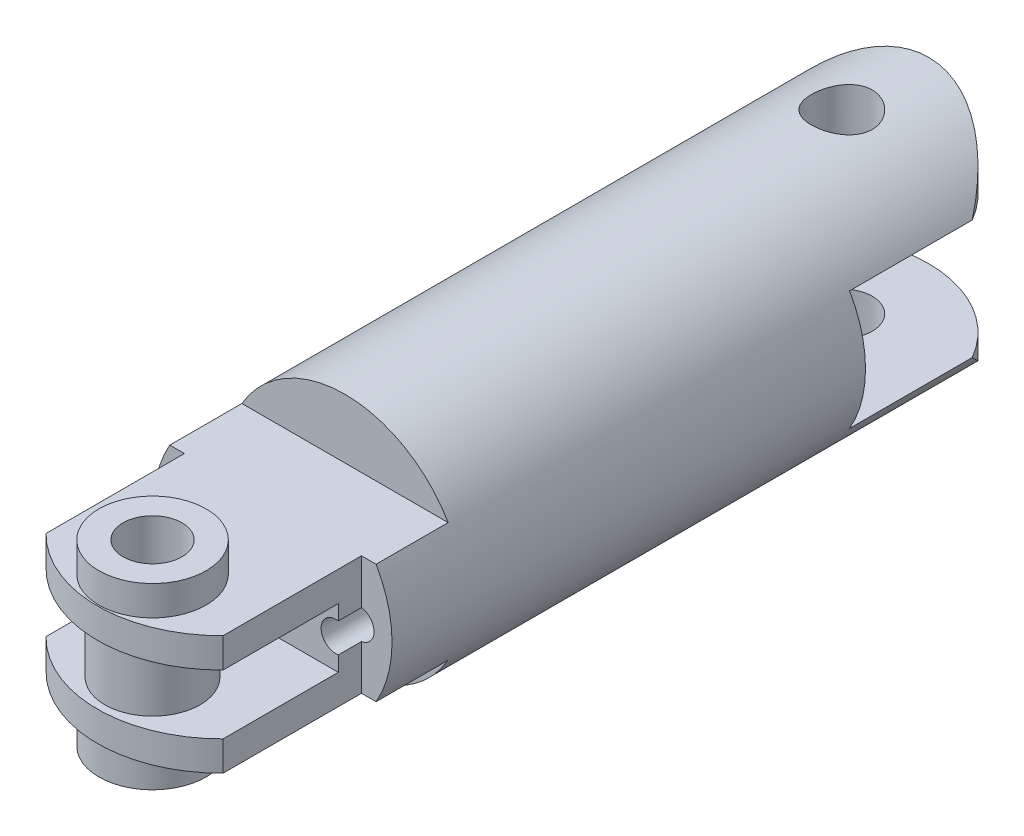
from build123d import *
from build123d.topology import SkipClean

# Parameters (mm, degrees)
SKETCH2_R                       = 10
PHALANGE_LENGTH_DEPTH           = 41.7
BOSS_EXTRUDE3_DEPTH             = 5
BOSS_EXTRUDE4_DEPTH             = 5
BOSS_EXTRUDE4_DEPTH_BACK        = 5
CUT_EXTRUDE2_START              = -15.3025
CUT_EXTRUDE2_DEPTH              = 15.3025
SKETCH7_R                       = 1.65
CUT_EXTRUDE3_DEPTH              = 10
CUT_EXTRUDE4_DEPTH              = 2.5
CUT_EXTRUDE4_DEPTH_BACK         = 2.5
CUT_EXTRUDE7_REACH              = 61.833
SKETCH4_R                       = 1.65
CUT_EXTRUDE7_DIRECTION_2_REACH  = 61.833
CUT_EXTRUDE_THIN1_START         = 41.7
CUT_EXTRUDE_THIN1_DEPTH         = 10.361670454
BOSS_EXTRUDE5_REACH             = 61.255
SKETCH9_R                       = 4
SKETCH9_R_2                     = 1.65
CUT_EXTRUDE8_REACH              = 60.731
SKETCH10_R                      = 1.25
CUT_EXTRUDE9_START              = -8
CUT_EXTRUDE9_DEPTH              = 8
CUT_EXTRUDE10_REACH             = 61.255
CUT_EXTRUDE10_DIRECTION_2_REACH = 61.255
CUT_EXTRUDE11_START             = -10
CUT_EXTRUDE11_OUTLINE_W         = 2.565773848
CUT_EXTRUDE11_OUTLINE_H         = 11.6166929
CUT_EXTRUDE11_DEPTH             = 10
BOSS_EXTRUDE6_START             = 7.5
SKETCH14_R                      = 4.5
SKETCH14_R_2                    = 1.65
BOSS_EXTRUDE6_DEPTH             = 2.5
BOSS_EXTRUDE7_START             = -7.5
SKETCH14_2_R                    = 4.5
SKETCH14_2_R_2                  = 1.65
BOSS_EXTRUDE7_DEPTH             = 2.5
SCALE1_SCALE                    = 0.666666667
CUT_EXTRUDE12_START             = -11.666667
SKETCH15_R                      = 1.65
CUT_EXTRUDE12_DEPTH             = 13.333339
CUT_EXTRUDE13_REACH             = 46.28
SKETCH16_R                      = 1.7
CUT_EXTRUDE13_DIRECTION_2_REACH = 46.28


# Read off the part's stored shape, not the designer's step: Cut-Extrude-Thin1, Cut-Extrude11
with BuildPart() as part:
    # Sketch2 → Phalange Length (new body)
    with BuildSketch(Plane.XY):
        Circle(SKETCH2_R)
    extrude(amount=PHALANGE_LENGTH_DEPTH)

    # Sketch3 → Boss-Extrude3 (add)
    with BuildSketch(Plane(origin=(0, -10, 0), x_dir=(-1, 0, 0), z_dir=(0, -1, 0))):
        with BuildLine():
            Line((-10, 5.302499701), (-10, 0))
            Line((-10, 0), (10, 0))
            Line((10, 0), (10, 5.302499701))
            ThreePointArc((10, 5.302499701), (0, 15.302499701), (-10, 5.302499701))
        make_face()
    boss_extrude3 = extrude(amount=-BOSS_EXTRUDE3_DEPTH)

    # Mirror1: Boss-Extrude3 across plane
    add(boss_extrude3.mirror(Plane.ZX))

    # Sketch5 → Boss-Extrude4 (add, two sides: drawn at the far end of the back side and taken through both)
    with BuildSketch(Plane(origin=(0, 0, 0), x_dir=(1, 0, 0), z_dir=(0, 1, 0)).offset(-BOSS_EXTRUDE4_DEPTH_BACK)):
        with BuildLine():
            Line((-10, -47.483157911), (-10, -41.7))
            Line((-10, -41.7), (10, -41.7))
            Line((10, -41.7), (10, -47.483157911))
            ThreePointArc((10, -47.483157911), (0, -57.051984156), (-10, -47.483157911))
        make_face()
    extrude(amount=BOSS_EXTRUDE4_DEPTH + BOSS_EXTRUDE4_DEPTH_BACK)

    # Sketch6 → Cut-Extrude2 (cut)
    with SkipClean():  # the faces are left unmerged after this step: merging them gives an invalid solid
        with BuildSketch(Plane.XY.offset(CUT_EXTRUDE2_START)):
            with BuildLine():
                ThreePointArc((0, 10), (5, 8.660254038), (8.660254038, 5))
                Line((8.660254038, 5), (10, 5))
                Line((10, 5), (10, 10))
                Line((10, 10), (0, 10))
            make_face()
            with BuildLine():
                Line((10, -5), (8.660254038, -5))
                ThreePointArc((8.660254038, -5), (5, -8.660254038), (0, -10))
                Line((0, -10), (10, -10))
                Line((10, -10), (10, -5))
            make_face()
            with BuildLine():
                ThreePointArc((-8.660254038, 5), (-5, 8.660254038), (0, 10))
                Line((0, 10), (-10, 10))
                Line((-10, 10), (-10, 5))
                Line((-10, 5), (-8.660254038, 5))
            make_face()
            with BuildLine():
                Line((-10, -10), (0, -10))
                ThreePointArc((0, -10), (-5, -8.660254038), (-8.660254038, -5))
                Line((-8.660254038, -5), (-10, -5))
                Line((-10, -5), (-10, -10))
            make_face()
        extrude(amount=CUT_EXTRUDE2_DEPTH, mode=Mode.SUBTRACT)

    # Sketch7 → Cut-Extrude3 (cut)
    with SkipClean():  # the faces are left unmerged after this step: merging them gives an invalid solid
        with BuildSketch(Plane(origin=(0, 5, 0), x_dir=(1, 0, 0), z_dir=(0, 1, 0))):
            with Locations(Location((0, -49.861984156, 0), (0, 0, 270))):
                Circle(SKETCH7_R)
        extrude(amount=-CUT_EXTRUDE3_DEPTH, mode=Mode.SUBTRACT)

    # Sketch5<2> → Cut-Extrude4 (cut, two sides: drawn at the far end of the back side and taken through both)
    with BuildSketch(Plane(origin=(0, 0, 0), x_dir=(1, 0, 0), z_dir=(0, 1, 0)).offset(-CUT_EXTRUDE4_DEPTH_BACK)):
        with BuildLine():
            Line((-10, -47.483157911), (-10, -41.7))
            Line((-10, -41.7), (10, -41.7))
            Line((10, -41.7), (10, -47.483157911))
            ThreePointArc((10, -47.483157911), (0, -57.051984156), (-10, -47.483157911))
        make_face()
    extrude(amount=CUT_EXTRUDE4_DEPTH + CUT_EXTRUDE4_DEPTH_BACK, mode=Mode.SUBTRACT)

    # Sketch4 → Cut-Extrude7 (cut, up to next)
    with BuildSketch(Plane(origin=(0, -5, 0), x_dir=(1, 0, 0), z_dir=(0, 1, 0)), mode=Mode.PRIVATE) as cut_extrude7_sk1:
        with Locations(Location((0, 8.010159673, 0), (0, 0, 270))):
            Circle(SKETCH4_R)
    cut_extrude7_tool1 = extrude(cut_extrude7_sk1.sketch, amount=-CUT_EXTRUDE7_REACH, mode=Mode.PRIVATE) & part.part
    add(cut_extrude7_tool1.solids().sort_by_distance((0, -5, -8.01016))[0], mode=Mode.SUBTRACT)

    # Sketch4 → Cut-Extrude7 direction 2 (cut, up to next)
    with BuildSketch(Plane(origin=(0, -5, 0), x_dir=(1, 0, 0), z_dir=(0, 1, 0)), mode=Mode.PRIVATE) as cut_extrude7_direction_2_sk1:
        with Locations(Location((0, 8.010159673, 0), (0, 0, 270))):
            Circle(SKETCH4_R)
    cut_extrude7_direction_2_tool1 = extrude(cut_extrude7_direction_2_sk1.sketch, amount=CUT_EXTRUDE7_DIRECTION_2_REACH, mode=Mode.PRIVATE) & part.part
    add(cut_extrude7_direction_2_tool1.solids().sort_by_distance((0, -5, -8.01016))[0], mode=Mode.SUBTRACT)

    # Cut-Extrude-Thin1 outline → Cut-Extrude-Thin1 (cut)
    with SkipClean():  # the faces are left unmerged after this step: merging them gives an invalid solid
        with BuildSketch(Plane.XY.offset(CUT_EXTRUDE_THIN1_START)):
            with BuildLine():
                ThreePointArc((8.660254038, 5), (9.256147934, 3.78466979), (9.682458366, 2.5))
                Line((9.682458366, 2.5), (10, 2.5))
                Line((10, 2.5), (10, 5))
                Line((10, 5), (8.660254038, 5))
            make_face()
            with BuildLine():
                Line((10, -2.5), (9.682458366, -2.5))
                ThreePointArc((9.682458366, -2.5), (9.256147934, -3.78466979), (8.660254038, -5))
                Line((8.660254038, -5), (10, -5))
                Line((10, -5), (10, -2.5))
            make_face()
            with BuildLine():
                Line((-10, 2.5), (-9.682458366, 2.5))
                ThreePointArc((-9.682458366, 2.5), (-9.256147934, 3.78466979), (-8.660254038, 5))
                Line((-8.660254038, 5), (-10, 5))
                Line((-10, 5), (-10, 2.5))
            make_face()
            with BuildLine():
                ThreePointArc((-8.660254038, -5), (-9.256147934, -3.78466979), (-9.682458366, -2.5))
                Line((-9.682458366, -2.5), (-10, -2.5))
                Line((-10, -2.5), (-10, -5))
                Line((-10, -5), (-8.660254038, -5))
            make_face()
        extrude(amount=CUT_EXTRUDE_THIN1_DEPTH, mode=Mode.SUBTRACT)

    # Sketch9 → Boss-Extrude5 (add, up to next)
    with BuildSketch(Plane.XZ.offset(-2.5), mode=Mode.PRIVATE) as boss_extrude5_sk1:
        with Locations(Location((0, 49.861984156, 0), (0, 0, 90))):
            Circle(SKETCH9_R)
        with Locations(Location((0, 49.861984156, 0), (0, 0, 90))):
            Circle(SKETCH9_R_2, mode=Mode.SUBTRACT)
    boss_extrude5_tool1 = extrude(boss_extrude5_sk1.sketch, amount=BOSS_EXTRUDE5_REACH, mode=Mode.PRIVATE) - part.part
    add(boss_extrude5_tool1.solids().sort_by_distance((0, 2.5, 45.975121))[0])

    # Sketch10 → Cut-Extrude8 (cut, up to next)
    with BuildSketch(Plane.XY.offset(41.7), mode=Mode.PRIVATE) as cut_extrude8_sk1:
        with Locations((7.239961745, 0)):
            Circle(SKETCH10_R)
    cut_extrude8_tool1 = extrude(cut_extrude8_sk1.sketch, amount=-CUT_EXTRUDE8_REACH, mode=Mode.PRIVATE) & part.part
    # Sketch10 → Cut-Extrude8 (cut, up to next)
    with BuildSketch(Plane.XY.offset(41.7), mode=Mode.PRIVATE) as cut_extrude8_sk2:
        with Locations((-7.239961745, 0)):
            Circle(SKETCH10_R)
    cut_extrude8_tool2 = extrude(cut_extrude8_sk2.sketch, amount=-CUT_EXTRUDE8_REACH, mode=Mode.PRIVATE) & part.part
    add(cut_extrude8_tool1.solids().sort_by_distance((7.239962, 0, 41.7))[0], mode=Mode.SUBTRACT)
    add(cut_extrude8_tool2.solids().sort_by_distance((-7.239962, 0, 41.7))[0], mode=Mode.SUBTRACT)

    # Sketch11 → Cut-Extrude9 (cut)
    with SkipClean():  # the faces are left unmerged after this step: merging them gives an invalid solid
        with BuildSketch(Plane.XY.offset(41.7).offset(CUT_EXTRUDE9_START)):
            with BuildLine():
                ThreePointArc((8.660254038, 5), (0, 10), (-8.660254038, 5))
                Line((-8.660254038, 5), (8.660254038, 5))
            make_face()
            with BuildLine():
                Line((8.660254038, -5), (-8.660254038, -5))
                ThreePointArc((-8.660254038, -5), (0, -10), (8.660254038, -5))
            make_face()
        extrude(amount=CUT_EXTRUDE9_DEPTH, mode=Mode.SUBTRACT)

    # Sketch12 → Cut-Extrude10 (cut, up to next)
    with BuildSketch(Plane.XZ.offset(-2.5), mode=Mode.PRIVATE) as cut_extrude10_sk1:
        with BuildLine():
            Line((-10.033719202, 57.051984156), (-10.033719202, 49.864892021))
            Line((-10.033719202, 49.864892021), (-8.660254038, 49.864892021))
            ThreePointArc((-8.660254038, 49.864892021), (0, 54.490740593), (8.660254038, 49.864892021))
            Line((8.660254038, 49.864892021), (10.033719202, 49.864892021))
            Line((10.033719202, 49.864892021), (10.033719202, 57.051984156))
            Line((10.033719202, 57.051984156), (-10.033719202, 57.051984156))
        make_face()
    cut_extrude10_tool1 = extrude(cut_extrude10_sk1.sketch, amount=CUT_EXTRUDE10_REACH, mode=Mode.PRIVATE) & part.part
    add(cut_extrude10_tool1.solids().sort_by_distance((0, 2.5, 54.550279))[0], mode=Mode.SUBTRACT)

    # Sketch12 → Cut-Extrude10 direction 2 (cut, up to next)
    with BuildSketch(Plane.XZ.offset(-2.5), mode=Mode.PRIVATE) as cut_extrude10_direction_2_sk1:
        with BuildLine():
            Line((-10.033719202, 57.051984156), (-10.033719202, 49.864892021))
            Line((-10.033719202, 49.864892021), (-8.660254038, 49.864892021))
            ThreePointArc((-8.660254038, 49.864892021), (0, 54.490740593), (8.660254038, 49.864892021))
            Line((8.660254038, 49.864892021), (10.033719202, 49.864892021))
            Line((10.033719202, 49.864892021), (10.033719202, 57.051984156))
            Line((10.033719202, 57.051984156), (-10.033719202, 57.051984156))
        make_face()
    cut_extrude10_direction_2_tool1 = extrude(cut_extrude10_direction_2_sk1.sketch, amount=-CUT_EXTRUDE10_DIRECTION_2_REACH, mode=Mode.PRIVATE) & part.part
    add(cut_extrude10_direction_2_tool1.solids().sort_by_distance((0, 2.5, 54.550279))[0], mode=Mode.SUBTRACT)

    # Cut-Extrude11 outline → Cut-Extrude11 (cut)
    with BuildSketch(Plane.XZ.offset(5).offset(CUT_EXTRUDE11_START)):
        with Locations((-8.717113076, 45.560571369)):
            Rectangle(CUT_EXTRUDE11_OUTLINE_W, CUT_EXTRUDE11_OUTLINE_H)
        with Locations((8.717113076, 45.560571369)):
            Rectangle(CUT_EXTRUDE11_OUTLINE_W, CUT_EXTRUDE11_OUTLINE_H)
    extrude(amount=CUT_EXTRUDE11_DEPTH, mode=Mode.SUBTRACT)

    # Sketch14 → Boss-Extrude6 (add)
    with SkipClean():  # the faces are left unmerged after this step: merging them gives an invalid solid
        with BuildSketch(Plane(origin=(0, 0, 0), x_dir=(1, 0, 0), z_dir=(0, 1, 0)).offset(BOSS_EXTRUDE6_START)):
            with Locations(Location((0, -49.861984156, 0), (0, 0, 270))):
                Circle(SKETCH14_R)
            with Locations(Location((0, -49.861984156, 0), (0, 0, 270))):
                Circle(SKETCH14_R_2, mode=Mode.SUBTRACT)
        extrude(amount=-BOSS_EXTRUDE6_DEPTH)

    # Sketch14<2> → Boss-Extrude7 (add)
    with SkipClean():  # the faces are left unmerged after this step: merging them gives an invalid solid
        with BuildSketch(Plane(origin=(0, 0, 0), x_dir=(1, 0, 0), z_dir=(0, 1, 0)).offset(BOSS_EXTRUDE7_START)):
            with Locations(Location((0, -49.861984156, 0), (0, 0, 270))):
                Circle(SKETCH14_2_R)
            with Locations(Location((0, -49.861984156, 0), (0, 0, 270))):
                Circle(SKETCH14_2_R_2, mode=Mode.SUBTRACT)
        extrude(amount=BOSS_EXTRUDE7_DEPTH)


with BuildPart() as part_1:
    # Scale1: scaled about (1e-09, 5e-08, 18.872441715)
    add(part.part.scale(SCALE1_SCALE).moved(Location((0, 1.7e-08, 6.290813905))))

    # Sketch15 → Cut-Extrude12 (cut)
    with BuildSketch(Plane(origin=(0, 4.999994989, 0), x_dir=(1, 0, 0), z_dir=(0, 1, 0)).offset(CUT_EXTRUDE12_START)):
        with Locations(Location((-4.1e-08, -39.532303396, 0), (0, 0, 270))):
            Circle(SKETCH15_R)
    extrude(amount=CUT_EXTRUDE12_DEPTH, mode=Mode.SUBTRACT)

    # Sketch16 → Cut-Extrude13 (cut, up to next)
    with BuildSketch(Plane.XZ.offset(-3.333328323), mode=Mode.PRIVATE) as cut_extrude13_sk1:
        with Locations(Location((-4.1e-08, 0.950874177, 0), (0, 0, 270))):
            Circle(SKETCH16_R)
    cut_extrude13_tool1 = extrude(cut_extrude13_sk1.sketch, amount=-CUT_EXTRUDE13_REACH, mode=Mode.PRIVATE) & part_1.part
    add(cut_extrude13_tool1.solids().sort_by_distance((0, 3.333328, 0.950874))[0], mode=Mode.SUBTRACT)

    # Sketch16 → Cut-Extrude13 direction 2 (cut, up to next)
    with BuildSketch(Plane.XZ.offset(-3.333328323), mode=Mode.PRIVATE) as cut_extrude13_direction_2_sk1:
        with Locations(Location((-4.1e-08, 0.950874177, 0), (0, 0, 270))):
            Circle(SKETCH16_R)
    cut_extrude13_direction_2_tool1 = extrude(cut_extrude13_direction_2_sk1.sketch, amount=CUT_EXTRUDE13_DIRECTION_2_REACH, mode=Mode.PRIVATE) & part_1.part
    add(cut_extrude13_direction_2_tool1.solids().sort_by_distance((0, 3.333328, 0.950874))[0], mode=Mode.SUBTRACT)


solid = part_1.part
